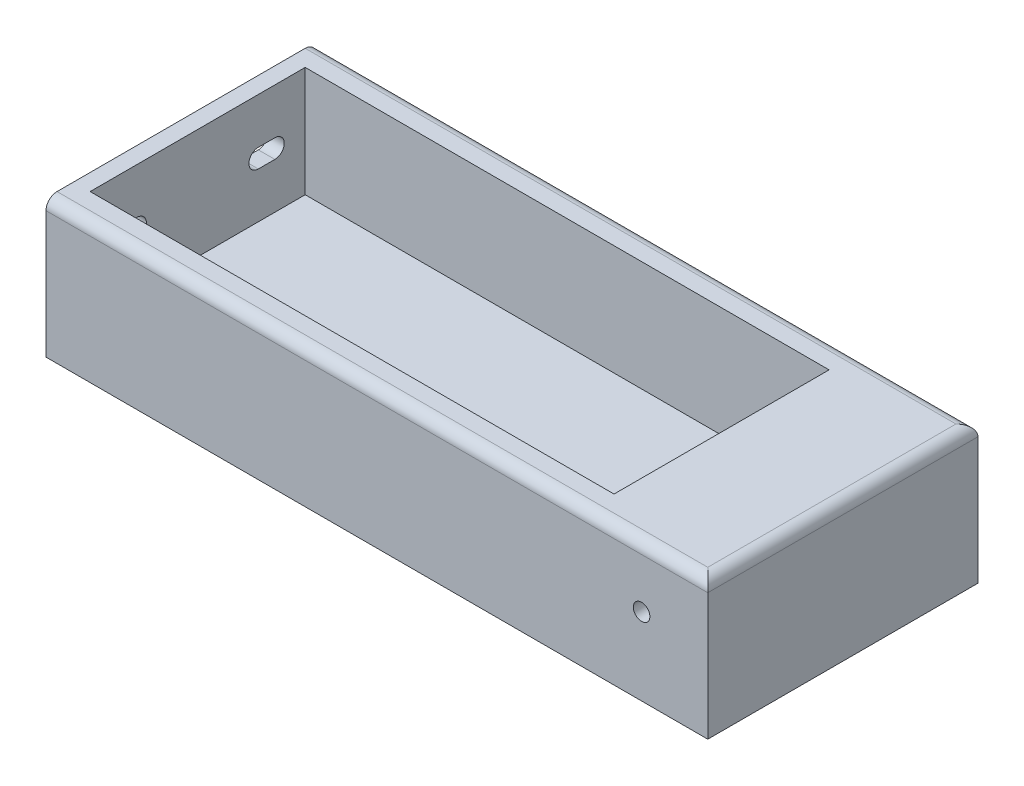
from build123d import *

# Parameters (mm, degrees)
SKETCH1_W                = 120
SKETCH1_H                = 49
BOSS_EXTRUDE1_DEPTH      = 12.5
SKETCH2_W                = 95
SKETCH2_H                = 39
CUT_EXTRUDE1_DEPTH       = 20
FILLET1_R                = 2
M3_START                 = -60
M3_CLEARANCE_SLOT1_DEPTH = 3
SKETCH6_R                = 5.5
CUT_EXTRUDE2_DEPTH       = 20
SKETCH7_R                = 1.5
CUT_EXTRUDE3_DEPTH       = 79.468146403


# Read off the part's stored shape, not the designer's step: M3 Clearance Slot1
with BuildPart() as part:
    # Sketch1 → Boss-Extrude1 (new, symmetric)
    with BuildSketch(Plane(origin=(0, 0, 0), x_dir=(1, 0, 0), z_dir=(0, 1, 0))):
        Rectangle(SKETCH1_W, SKETCH1_H)
    extrude(amount=BOSS_EXTRUDE1_DEPTH, both=True)

    # Sketch2 → Cut-Extrude1 (cut)
    with BuildSketch(Plane(origin=(0, 12.5, 0), x_dir=(1, 0, 0), z_dir=(0, 1, 0))):
        with Locations((-9.5, 0)):
            Rectangle(SKETCH2_W, SKETCH2_H)
    extrude(amount=-CUT_EXTRUDE1_DEPTH, mode=Mode.SUBTRACT)

    # Fillet1
    fillet1_edges = [part.edges().sort_by_distance(p)[0] for p in [
        (0, 12.5, 24.5),
        (60, 12.5, 0),
        (0, 12.5, -24.5),
    ]]
    fillet(fillet1_edges, radius=FILLET1_R)

    # M3 Clearance Slot1 outline → M3 Clearance Slot1 (cut)
    with BuildSketch(Plane.YZ.offset(M3_START)):
        with BuildLine():
            Line((4.2, -14), (4.2, -11))
            ThreePointArc((4.2, -11), (2.5, -9.3), (0.8, -11))
            Line((0.8, -11), (0.8, -14))
            ThreePointArc((0.8, -14), (2.5, -15.7), (4.2, -14))
        make_face()
        with BuildLine():
            ThreePointArc((4.2, 14), (2.5, 15.7), (0.8, 14))
            Line((0.8, 14), (0.8, 11))
            ThreePointArc((0.8, 11), (2.5, 9.3), (4.2, 11))
            Line((4.2, 11), (4.2, 14))
        make_face()
    extrude(amount=M3_CLEARANCE_SLOT1_DEPTH, mode=Mode.SUBTRACT)

    # Sketch6 → Cut-Extrude2 (cut)
    with BuildSketch(Plane.XZ.offset(12.5)):
        with Locations(Location((48, 0, 0), (0, 0, 270))):
            Circle(SKETCH6_R)
    extrude(amount=-CUT_EXTRUDE2_DEPTH, mode=Mode.SUBTRACT)

    # Sketch7 → Cut-Extrude3 (cut, through all)
    with BuildSketch(Plane(origin=(0, 0, -24.5), x_dir=(-1, 0, 0), z_dir=(0, 0, -1))):
        with Locations((-48, 1.5)):
            Circle(SKETCH7_R)
    extrude(amount=-CUT_EXTRUDE3_DEPTH, mode=Mode.SUBTRACT)


solid = part.part
